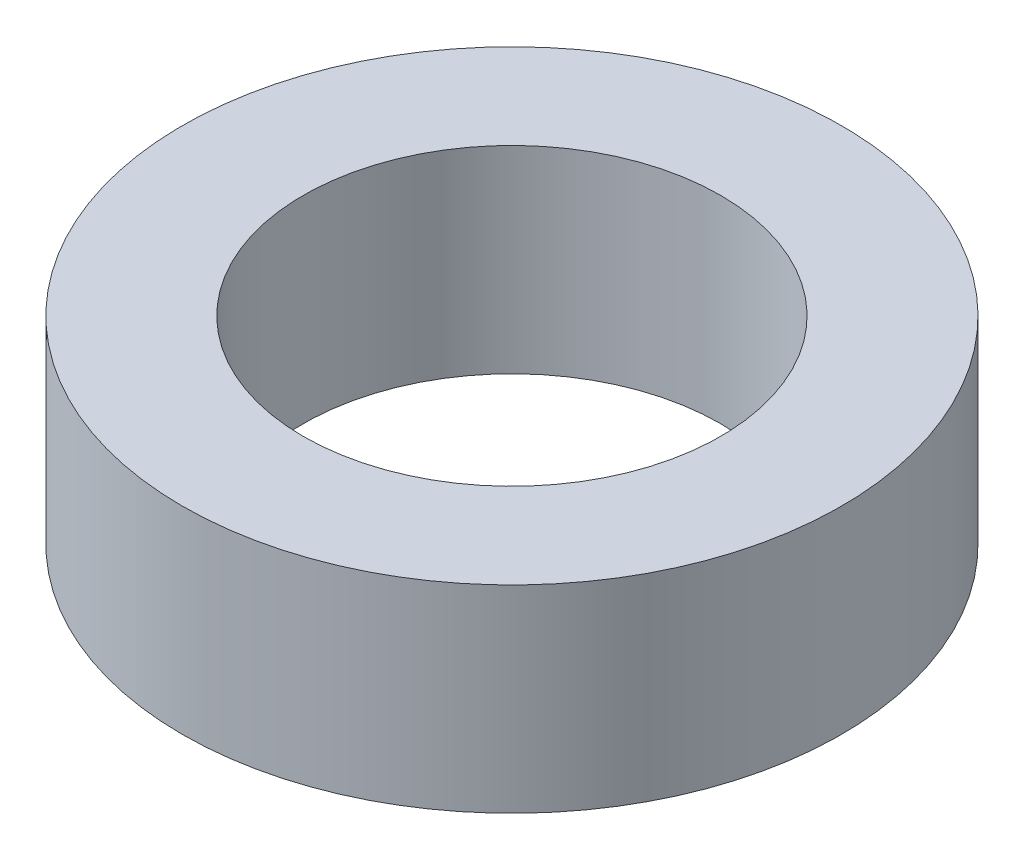
from build123d import *

# Parameters (mm, degrees)
SKETCH1_R           = 15
BOSS_EXTRUDE1_DEPTH = 9
SKETCH5_R           = 9.5
CUT_EXTRUDE3_DEPTH  = 24.043437244


with BuildPart() as part:
    # Sketch1 → Boss-Extrude1 (new body)
    with BuildSketch(Plane(origin=(0, 0, 0), x_dir=(1, 0, 0), z_dir=(0, 1, 0))):
        Circle(SKETCH1_R)
    extrude(amount=BOSS_EXTRUDE1_DEPTH)

    # Sketch5 → Cut-Extrude3 (cut, through all)
    with BuildSketch(Plane(origin=(0, 9, 0), x_dir=(1, 0, 0), z_dir=(0, 1, 0))):
        Circle(SKETCH5_R)
    extrude(amount=-CUT_EXTRUDE3_DEPTH, mode=Mode.SUBTRACT)


solid = part.part
